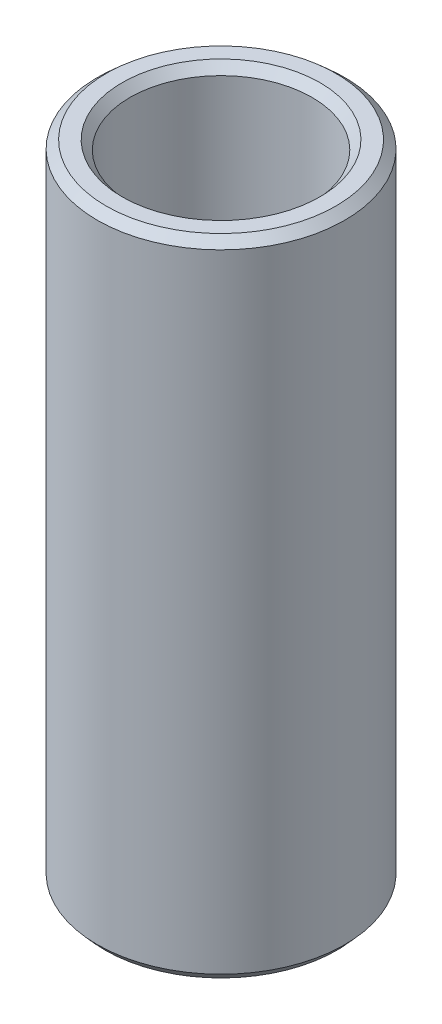
from build123d import *
from OCP.BRepFilletAPI import BRepFilletAPI_MakeChamfer

# Parameters (mm, degrees)
SKETCH1_R           = 55
BOSS_EXTRUDE1_DEPTH = 286.313399576
SKETCH2_R           = 40.477914616
CUT_EXTRUDE1_DEPTH  = 297.690685355
CHAMFER1_SIZE       = 3.508717743
CHAMFER1_SIZE2      = 3.924445734


with BuildPart() as part:
    # Sketch1 → Boss-Extrude1 (new body)
    with BuildSketch(Plane(origin=(0, 0, 0), x_dir=(1, 0, 0), z_dir=(0, 1, 0))):
        Circle(SKETCH1_R)
    extrude(amount=BOSS_EXTRUDE1_DEPTH)

    # Sketch2 → Cut-Extrude1 (cut, through all)
    with BuildSketch(Plane(origin=(0, 0, 0), x_dir=(1, 0, 0), z_dir=(0, 1, 0))):
        Circle(SKETCH2_R)
    extrude(amount=CUT_EXTRUDE1_DEPTH, mode=Mode.SUBTRACT)

    # Chamfer1: one chamfer whose edges measure the first distance from different faces: ONE call of the kernel's chamfer builder (chamfer() names one face for all edges)
    chamfer1_edges_1 = [part.edges().sort_by_distance(p)[0] for p in [
        (-40.477914616, 286.313399576, 0),
    ]]
    chamfer1_side_1 = [part.faces().sort_by_distance(p)[0] for p in [
        (-53.444365081, 286.313399576, 0),
    ]]
    chamfer1_edges_2 = [part.edges().sort_by_distance(p)[0] for p in [
        (-40.477914616, 0, 0),
    ]]
    chamfer1_side_2 = [part.faces().sort_by_distance(p)[0] for p in [
        (-40.477914616, 143.156699788, 0),
    ]]
    chamfer1_edges_3 = [part.edges().sort_by_distance(p)[0] for p in [
        (-55, 0, 0),
    ]]
    chamfer1_side_3 = [part.faces().sort_by_distance(p)[0] for p in [
        (-53.444365081, 0, 0),
    ]]
    chamfer1_edges_4 = [part.edges().sort_by_distance(p)[0] for p in [
        (-55, 286.313399576, 0),
    ]]
    chamfer1_side_4 = [part.faces().sort_by_distance(p)[0] for p in [
        (-55, 143.156699788, 0),
    ]]
    chamfer1 = BRepFilletAPI_MakeChamfer(part.part.solid().wrapped)
    for e in chamfer1_edges_1:
        chamfer1.Add(CHAMFER1_SIZE, CHAMFER1_SIZE2, e.wrapped, chamfer1_side_1[0].wrapped)  # the first distance lies on this face
    for e in chamfer1_edges_2:
        chamfer1.Add(CHAMFER1_SIZE, CHAMFER1_SIZE2, e.wrapped, chamfer1_side_2[0].wrapped)  # the first distance lies on this face
    for e in chamfer1_edges_3:
        chamfer1.Add(CHAMFER1_SIZE, CHAMFER1_SIZE2, e.wrapped, chamfer1_side_3[0].wrapped)  # the first distance lies on this face
    for e in chamfer1_edges_4:
        chamfer1.Add(CHAMFER1_SIZE, CHAMFER1_SIZE2, e.wrapped, chamfer1_side_4[0].wrapped)  # the first distance lies on this face
    add(Compound.cast(chamfer1.Shape()), mode=Mode.REPLACE)


solid = part.part
